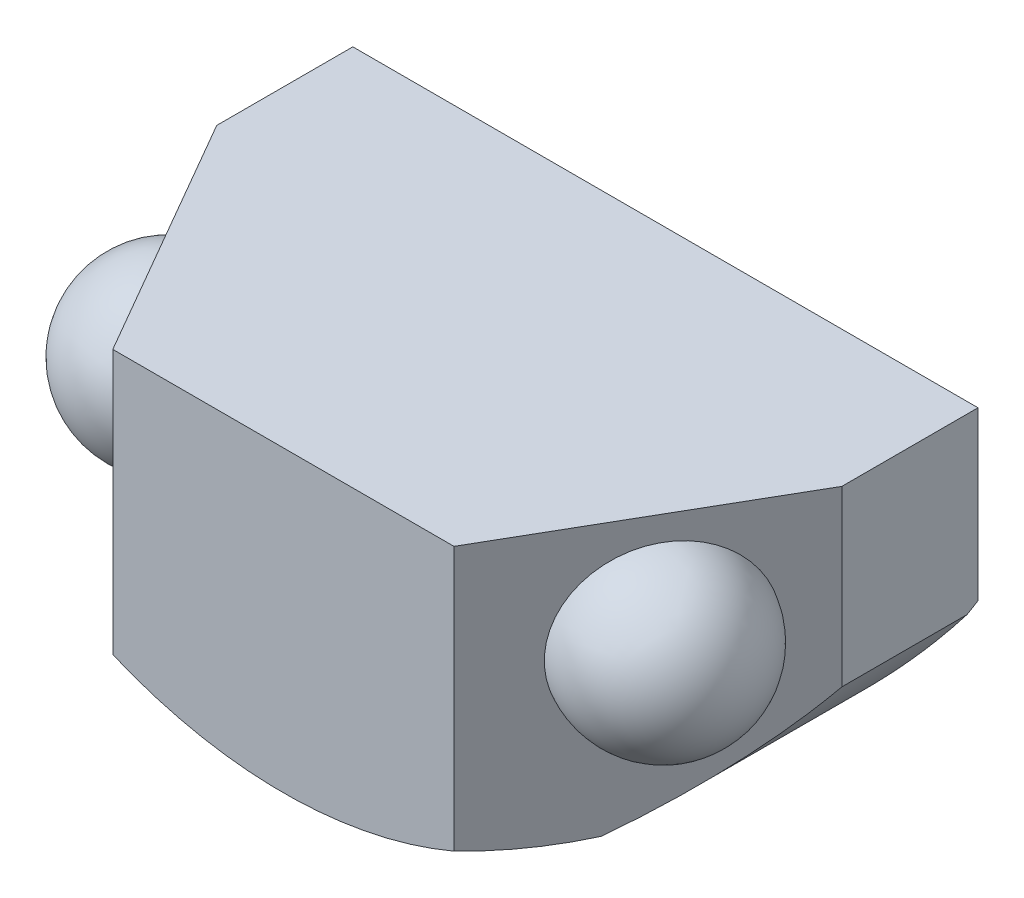
from build123d import *
from build123d.topology import SkipClean

# Parameters (mm, degrees)
SKETCH1_W                = 180
SKETCH1_H                = 110
BOSS_EXTRUDE1_DEPTH      = 50
BOSS_EXTRUDE2_DEPTH      = 110
CUT_EXTRUDE1_DEPTH       = 146.344418537
BOSS_EXTRUDE5_DEPTH      = 10
BOSS_EXTRUDE5_DEPTH_BACK = 10
SKETCH5_R                = 5


with BuildPart() as part:
    # Sketch1 → Boss-Extrude1 (new body)
    with BuildSketch(Plane(origin=(0, 0, 0), x_dir=(1, 0, 0), z_dir=(0, 1, 0))):
        Rectangle(SKETCH1_W, SKETCH1_H)
    extrude(amount=BOSS_EXTRUDE1_DEPTH)

    # Sketch2 → Boss-Extrude2 (add)
    with BuildSketch(Plane(origin=(-35, 0, -55), x_dir=(1, 0, 0), z_dir=(0, 0, 1))):
        with BuildLine():
            Line((-55, 0), (125, 0))
            ThreePointArc((125, 0), (35, -50), (-55, 0))
        make_face()
    extrude(amount=BOSS_EXTRUDE2_DEPTH)

    # Sketch3 → Cut-Extrude1 (cut, through all)
    with BuildSketch(Plane(origin=(0, 50, 0), x_dir=(1, 0, 0), z_dir=(0, 1, 0))):
        Polygon((-49.118803686, -55), (-90, 15.808309091), (-90, -55), align=None)
    cut_extrude1 = extrude(amount=-CUT_EXTRUDE1_DEPTH, mode=Mode.SUBTRACT)

    # Mirror1: Cut-Extrude1 across plane
    add(cut_extrude1.mirror(Plane(origin=(0, 0, 0), x_dir=(0, 0, 1), z_dir=(1, 0, 0))), mode=Mode.SUBTRACT)

    # Sketch5 → Boss-Extrude5 (add, two sides: drawn at the far end of the back side and taken through both)
    with BuildSketch(Plane(origin=(0, 0, -55), x_dir=(-1, 0, 0), z_dir=(0, 0, -1)).offset(-BOSS_EXTRUDE5_DEPTH_BACK)):
        Circle(SKETCH5_R)
    extrude(amount=BOSS_EXTRUDE5_DEPTH + BOSS_EXTRUDE5_DEPTH_BACK)

    # Sketch4 → Revolve1 (revolve)
    with BuildSketch(Plane(origin=(-60.654801368, 0, 35.019065898), x_dir=(0.49999999999999495, 0, 0.8660254037844417), z_dir=(-0.8660254037844417, 0, 0.49999999999999495))):
        with BuildLine():
            ThreePointArc((-20.965161058, 42.942576489), (4.034838942, 17.942576489), (-20.965161058, -7.057423511))
            Line((-20.965161058, -7.057423511), (-20.965161058, 42.942576489))
        make_face()
    revolve1 = revolve(axis=Axis((-71.137381897, 42.942576489, 16.862703827), (0, -1, 0)))

    # Mirror2: Revolve1 across plane
    add(revolve1.mirror(Plane(origin=(0, 0, 0), x_dir=(0, 0, 1), z_dir=(1, 0, 0))))


with BuildPart() as body_2:
    # Sketch6 → Revolve2 (revolve)
    with SkipClean():  # the faces are left unmerged after this step: merging them gives an invalid solid
        with BuildSketch(Plane.XY):
            with BuildLine():
                ThreePointArc((137.389580355, 89.999956455), (-0.110419645, 227.499956455), (-137.610419645, 89.999956455))
                Line((-137.610419645, 89.999956455), (137.389580355, 89.999956455))
            make_face()
            with BuildLine():
                Line((137.389580355, 89.999956455), (-137.610419645, 89.999956455))
                ThreePointArc((-137.610419645, 89.999956455), (-0.110419645, -47.500043545), (137.389580355, 89.999956455))
            make_face()
        revolve(axis=Axis((-137.610419645, 89.999956455, 0), (1, 0, 0)))
    add(body_2.part.scale(1), mode=Mode.REPLACE)  # the faces are merged on a copy

    # Intersect1: read off the stored shape, not the designer's step
    # Intersect1: intersect part
    add(part.part, mode=Mode.INTERSECT)


solid = body_2.part
